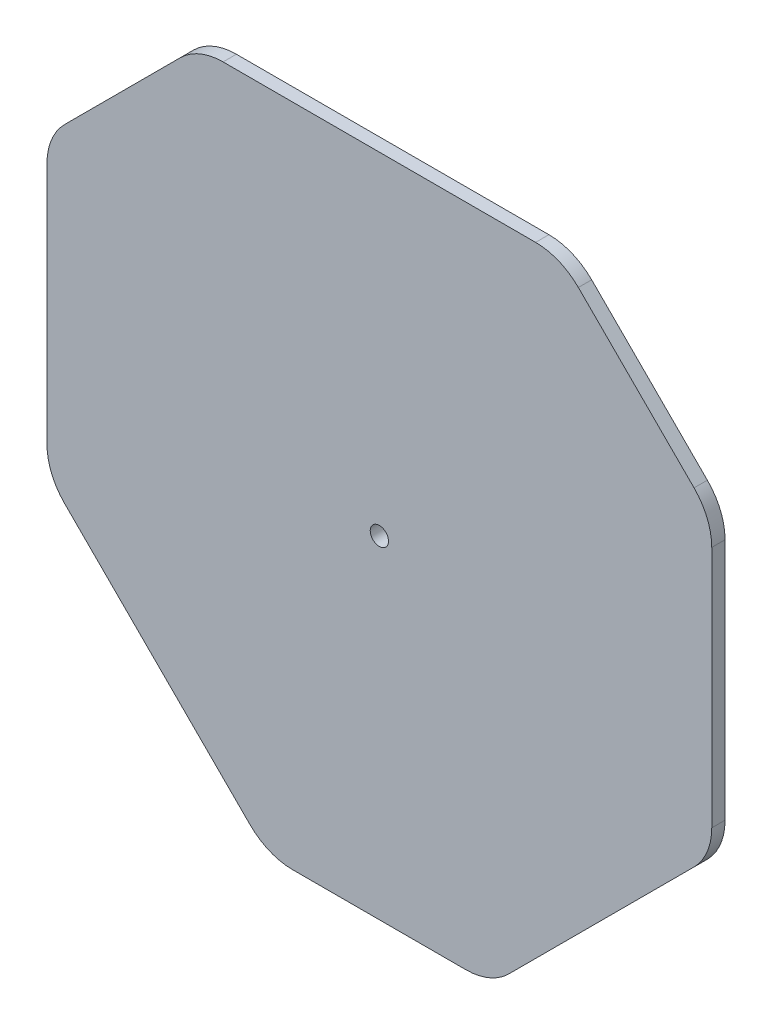
from build123d import *

# Parameters (mm, degrees)
BOSS_EXTRUDE1_DEPTH = 5.588
CAVITY1_OUTLINE_R   = 3.834765
CAVITY1_DEPTH       = 5.588


# Read off the part's stored shape, not the designer's step: Cavity1
with BuildPart() as part:
    # Sketch1 → Boss-Extrude1 (new body)
    with BuildSketch(Plane.XY):
        with BuildLine():
            Line((65.678975516, 61.334336478), (-65.678975516, 61.334336478))
            ThreePointArc((-65.678975516, 61.334336478), (-75.399134698, 59.400876604), (-83.639487758, 53.89484872))
            Line((-83.639487758, 53.89484872), (-132.260512242, 5.273824236))
            ThreePointArc((-132.260512242, 5.273824236), (-137.766540126, -2.966528824), (-139.7, -12.686688006))
            Line((-139.7, -12.686688006), (-139.7, -114.753454114))
            ThreePointArc((-139.7, -114.753454114), (-137.766540126, -124.473613296), (-132.260512242, -132.713966356))
            Line((-132.260512242, -132.713966356), (-54.348302834, -210.626175764))
            ThreePointArc((-54.348302834, -210.626175764), (-46.107949774, -216.132203648), (-36.387790592, -218.065663522))
            Line((-36.387790592, -218.065663522), (36.387790592, -218.065663522))
            ThreePointArc((36.387790592, -218.065663522), (46.107949774, -216.132203648), (54.348302834, -210.626175764))
            Line((54.348302834, -210.626175764), (132.260512242, -132.713966356))
            ThreePointArc((132.260512242, -132.713966356), (137.766540126, -124.473613296), (139.7, -114.753454114))
            Line((139.7, -114.753454114), (139.7, -12.686688006))
            ThreePointArc((139.7, -12.686688006), (137.766540126, -2.966528824), (132.260512242, 5.273824236))
            Line((132.260512242, 5.273824236), (83.639487758, 53.89484872))
            ThreePointArc((83.639487758, 53.89484872), (75.399134698, 59.400876604), (65.678975516, 61.334336478))
        make_face()
    extrude(amount=BOSS_EXTRUDE1_DEPTH)

    # Cavity1 outline → Cavity1 (cut)
    with BuildSketch(Plane.XY):
        with Locations((0, -78.365663522)):
            Circle(CAVITY1_OUTLINE_R)
    extrude(amount=CAVITY1_DEPTH, mode=Mode.SUBTRACT)


solid = part.part
